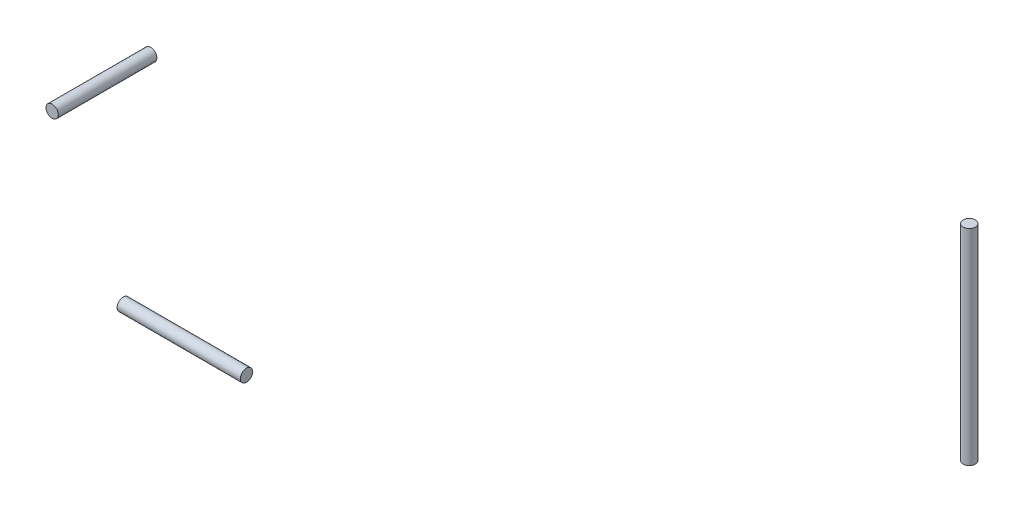
from build123d import *

# Parameters (mm, degrees)
TC1_SPRING_START    = 38
SKETCH1_R           = 0.75
TC1_SPRING_DEPTH    = 12
TC2_AIR_START       = 190
SKETCH2_R           = 0.75
TC2_AIR_DEPTH       = 25
TC3_REFLECTOR_START = 89
SKETCH3_R           = 0.75
TC3_REFLECTOR_DEPTH = 15


with BuildPart() as part:
    # Sketch1 → tc1_spring (new body)
    with BuildSketch(Plane.XY.offset(TC1_SPRING_START)):
        with Locations((66.34, 221)):
            Circle(SKETCH1_R)
    extrude(amount=TC1_SPRING_DEPTH)


with BuildPart() as body_2:
    # Sketch2 → tc2_air (new body)
    with BuildSketch(Plane(origin=(0, 0, 0), x_dir=(1, 0, 0), z_dir=(0, 1, 0)).offset(TC2_AIR_START)):
        with Locations((128, 0)):
            Circle(SKETCH2_R)
    extrude(amount=TC2_AIR_DEPTH)


with BuildPart() as body_3:
    # Sketch3 → tc3_reflector (new body)
    with BuildSketch(Plane(origin=(0, 0, 0), x_dir=(0, 0, -1), z_dir=(1, 0, 0)).offset(TC3_REFLECTOR_START)):
        with Locations((-64, 219)):
            Circle(SKETCH3_R)
    extrude(amount=TC3_REFLECTOR_DEPTH)


solid = Compound([part.part, body_2.part, body_3.part])
